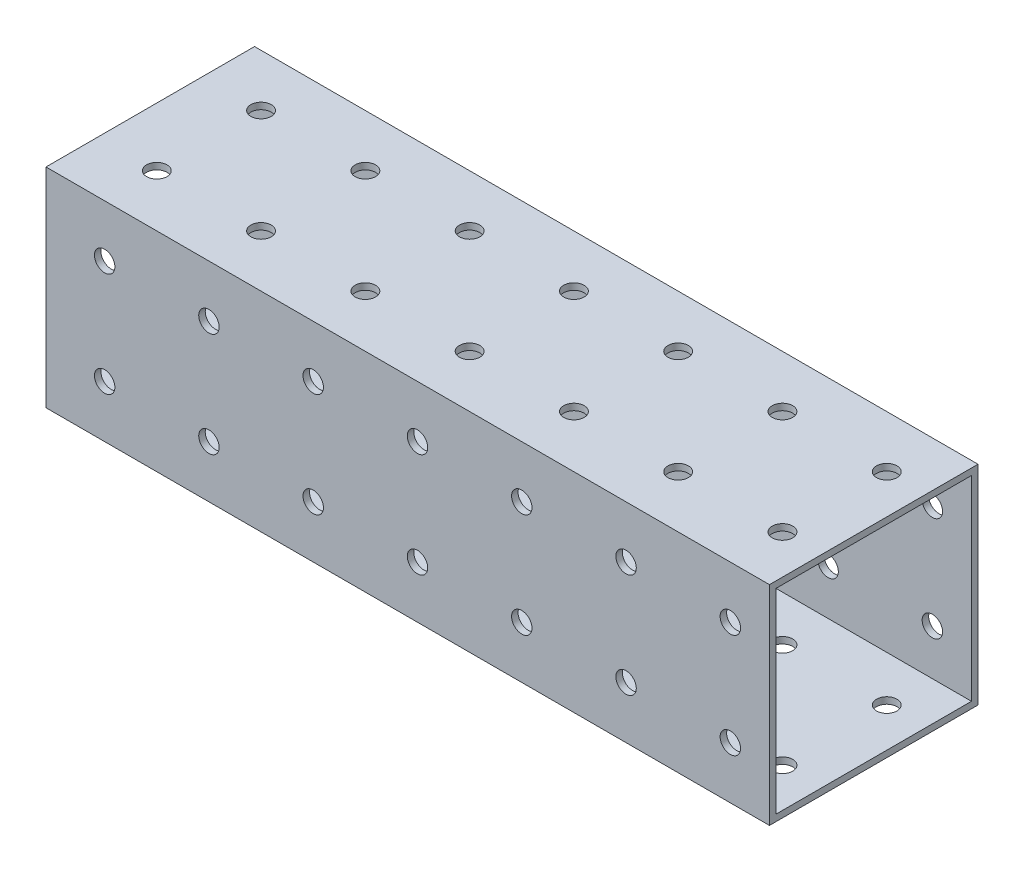
from build123d import *

# Parameters (mm, degrees)
SKETCH1_W           = 50.8
SKETCH1_H           = 50.8
BOSS_EXTRUDE1_DEPTH = 176.2125
SHELL1_T            = -1.5875
SKETCH2_R           = 2.4892
CUT_EXTRUDE3_DEPTH  = 191.29483744
SKETCH3_R           = 2.4892
CUT_EXTRUDE2_DEPTH  = 191.29483744
LPATTERN1_COUNT     = 7
LPATTERN1_PITCH     = 25.4


with BuildPart() as part:
    # Sketch1 → Boss-Extrude1 (new body)
    with BuildSketch(Plane(origin=(0, 0, 0), x_dir=(0, 0, -1), z_dir=(1, 0, 0))):
        with Locations((25.4, 25.4)):
            Rectangle(SKETCH1_W, SKETCH1_H)
    extrude(amount=BOSS_EXTRUDE1_DEPTH)

    # Shell1
    shell1_openings = [part.faces().sort_by_distance(p)[0] for p in [
        (0, 25.4, -25.4),
        (176.2125, 25.4, -25.4),
    ]]
    offset(amount=SHELL1_T, openings=shell1_openings, kind=Kind.INTERSECTION)

    # Sketch2 → Cut-Extrude3 (cut, through all)
    with BuildSketch(Plane(origin=(0, 0, -50.8), x_dir=(-1, 0, 0), z_dir=(0, 0, -1))):
        with Locations((-166.6875, 38.1)):
            Circle(SKETCH2_R)
        with Locations((-166.6875, 12.7)):
            Circle(SKETCH2_R)
    cut_extrude3 = extrude(amount=-CUT_EXTRUDE3_DEPTH, mode=Mode.SUBTRACT)

    # Sketch3 → Cut-Extrude2 (cut, through all)
    with BuildSketch(Plane.XZ):
        with Locations((166.6875, -12.7)):
            Circle(SKETCH3_R)
        with Locations((166.6875, -38.1)):
            Circle(SKETCH3_R)
    cut_extrude2 = extrude(amount=-CUT_EXTRUDE2_DEPTH, mode=Mode.SUBTRACT)

    # LPattern1: Cut-Extrude3, Cut-Extrude2 ×7
    with Locations(*[(-i * LPATTERN1_PITCH, 0, 0) for i in range(1, LPATTERN1_COUNT)]):
        add(cut_extrude3, mode=Mode.SUBTRACT)
        add(cut_extrude2, mode=Mode.SUBTRACT)


solid = part.part
